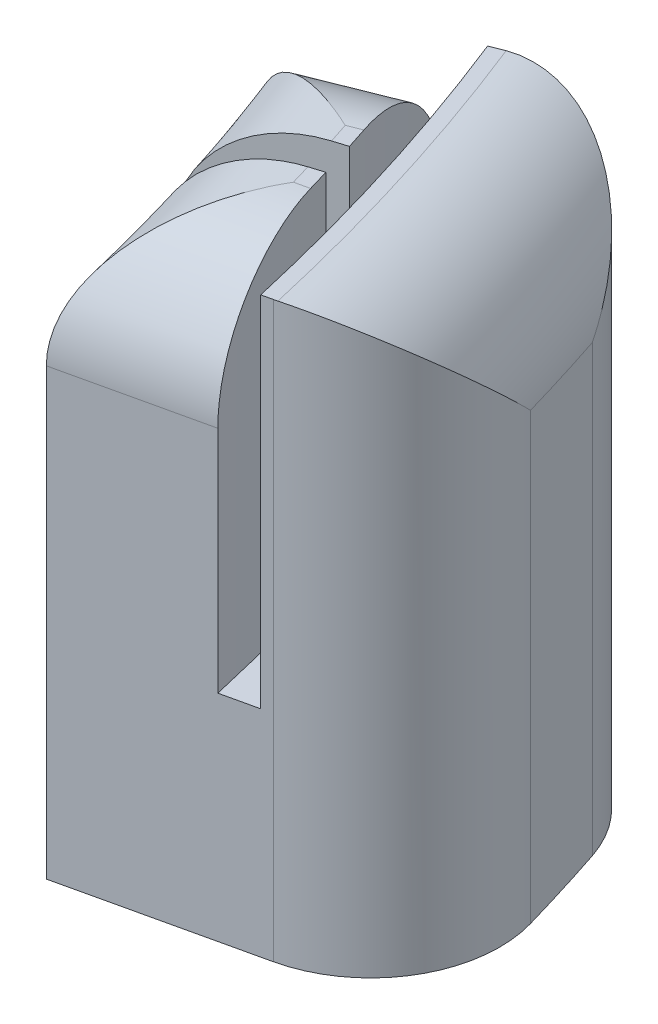
from build123d import *

# Parameters (mm, degrees)
EXTRUDE_1_DEPTH     = 400
CUT_EXTRUDE_START   = -250
CUT_EXTRUDE_1_DEPTH = 250
SKETCH_3_R          = 15.665420251
SKETCH_3_R_2        = 18.510518013
CUT_EXTRUDE_2_DEPTH = 50
FILLET_2_R          = 90
FILLET_3_R          = 90
EXTRUDE_START       = 50
SKETCH_4_R          = 18.510518013
SKETCH_4_R_2        = 15.665420251
EXTRUDE_2_DEPTH     = 50
SKETCH_8_R          = 25
CUT_EXTRUDE_3_DEPTH = 100


with BuildPart() as part:
    # 草图1 → 凸台-拉伸1 (new body)
    with BuildSketch(Plane(origin=(0, 0, 0), x_dir=(1, 0, 0), z_dir=(0, 1, 0))):
        with BuildLine():
            ThreePointArc((1355.07847299, 407.415429308), (1351.426521797, 419.370189907), (1347.669105677, 431.292222979))
            ThreePointArc((1347.669105677, 431.292222979), (1331.935587475, 477.674147112), (1314.606303382, 523.483779222))
            Line((1314.606303382, 523.483779222), (1407.51134249, 560.479099308))
            Line((1407.51134249, 560.479099308), (1430.737602267, 569.72792933))
            Line((1430.737602267, 569.72792933), (1523.642641375, 606.723249416))
            ThreePointArc((1523.642641375, 606.723249416), (1566.317664839, 486.054495722), (1599.452391748, 362.425228886))
            Line((1599.452391748, 362.425228886), (1501.924806885, 340.326129564))
            Line((1501.924806885, 340.326129564), (1477.542910669, 334.801354733))
            Line((1477.542910669, 334.801354733), (1380.015325807, 312.702255411))
            ThreePointArc((1380.015325807, 312.702255411), (1368.366605987, 360.27466136), (1355.07847299, 407.415429308))
        make_face()
    extrude(amount=EXTRUDE_1_DEPTH)

    # 草图2 → 切除-拉伸1 (cut)
    with BuildSketch(Plane(origin=(0, 400, 0), x_dir=(1, 0, 0), z_dir=(0, 1, 0)).offset(CUT_EXTRUDE_START)):
        with BuildLine():
            Line((1347.669105677, 431.292222979), (1443.179761176, 460.930772385))
            ThreePointArc((1443.179761176, 460.930772385), (1426.214363088, 511.016233129), (1407.51134249, 560.479099308))
            Line((1407.51134249, 560.479099308), (1430.737602267, 569.72792933))
            ThreePointArc((1430.737602267, 569.72792933), (1470.810490154, 456.417026471), (1501.924806885, 340.326129564))
            Line((1501.924806885, 340.326129564), (1477.542910669, 334.801354733))
            ThreePointArc((1477.542910669, 334.801354733), (1464.958432674, 386.162906732), (1450.589128489, 437.053978714))
            Line((1450.589128489, 437.053978714), (1355.07847299, 407.415429308))
            ThreePointArc((1355.07847299, 407.415429308), (1351.426521797, 419.370189907), (1347.669105677, 431.292222979))
        make_face()
    extrude(amount=CUT_EXTRUDE_1_DEPTH, mode=Mode.SUBTRACT)

    # 草图3 → 切除-拉伸2 (cut)
    with BuildSketch(Plane.XZ):
        with Locations(Location((1537.673756185, -404.548414334, 0), (0, 0, 270))):
            Circle(SKETCH_3_R)
        with Locations(Location((1496.563725778, -537.026083805, 0), (0, 0, 270))):
            Circle(SKETCH_3_R_2)
    extrude(amount=-CUT_EXTRUDE_2_DEPTH, mode=Mode.SUBTRACT)

    # 圆角2
    fillet_2_edges = [part.edges().sort_by_distance(p)[0] for p in [
        (1523.642641375, 200, -606.723249416),
        (1599.452391748, 200, -362.425228886),
        (1566.317664839, 400, -486.054495722),
    ]]
    fillet(fillet_2_edges, radius=FILLET_2_R)

    # 圆角3
    # the kernel refuses this fillet: 90 mm, written as the material it takes off along each edge
    with BuildSketch(Plane(origin=(0, 400, 0), x_dir=(0.9886635459067241, 0, -0.15014790373209708), z_dir=(0.15014790373209708, 0, 0.9886635459067241))) as fillet_3_piece_1_section:
        with BuildLine():
            CenterArc((1415 + FILLET_3_R, -FILLET_3_R), FILLET_3_R, 90, 90)
            Line((1415 + FILLET_3_R, 0), (1415 + FILLET_3_R, FILLET_3_R * 0.02))
            Line((1415 + FILLET_3_R, FILLET_3_R * 0.02), (1415 - FILLET_3_R * 0.02, FILLET_3_R * 0.02))
            Line((1415 - FILLET_3_R * 0.02, FILLET_3_R * 0.02), (1415 - FILLET_3_R * 0.02, -FILLET_3_R))
            Line((1415 - FILLET_3_R * 0.02, -FILLET_3_R), (1415, -FILLET_3_R))
        make_face()
    fillet_3_piece_1 = revolve(axis=Axis((0, 400, 0), (0, 1, 0)), revolution_arc=13.077233198, mode=Mode.PRIVATE)
    fillet_3_piece_1 = split(fillet_3_piece_1, bisect_by=Plane(origin=(1365.899074688, 379.798837266, -436.949286418), z_dir=(-0.2963746925135586, 0, -0.9550717468533417)), keep=Keep.TOP, mode=Mode.PRIVATE)
    add(fillet_3_piece_1, mode=Mode.SUBTRACT)
    with BuildSketch(Plane(origin=(1696.97997661, 400, -384.524328208), x_dir=(0, -1, 0), z_dir=(-0.9752758486265656, 0, 0.22099099322310048))) as fillet_3_piece_2_section:
        with BuildLine():
            CenterArc((FILLET_3_R, -FILLET_3_R), FILLET_3_R, 90, 90)
            Line((0, -FILLET_3_R), (-FILLET_3_R * 0.02, -FILLET_3_R))
            Line((-FILLET_3_R * 0.02, -FILLET_3_R), (-FILLET_3_R * 0.02, FILLET_3_R * 0.02))
            Line((-FILLET_3_R * 0.02, FILLET_3_R * 0.02), (FILLET_3_R, FILLET_3_R * 0.02))
            Line((FILLET_3_R, FILLET_3_R * 0.02), (FILLET_3_R, 0))
        make_face()
    fillet_3_piece_2 = extrude(amount=550, mode=Mode.PRIVATE)
    fillet_3_piece_2 = fillet_3_piece_2 - Plane(origin=(0, 379.627251668, 0), x_dir=(0.9752758486265642, 0, -0.22099099322310606), z_dir=(0, -1, 0)) * Cylinder(1415, 1461, mode=Mode.PRIVATE)
    fillet_3_piece_2 = fillet_3_piece_2 & Plane(origin=(0, 379.627251668, 0), x_dir=(0.9752758486265641, 0, -0.22099099322310678), z_dir=(0, -1, 0)) * Cylinder(1515, 1461, mode=Mode.PRIVATE)
    add(fillet_3_piece_2, mode=Mode.SUBTRACT)
    with BuildSketch(Plane(origin=(1105.569965388, 400, -440.244309028), x_dir=(0, -1, 0), z_dir=(0.9290503910825915, 0, -0.36995320086368216))) as fillet_3_piece_3_section:
        with BuildLine():
            CenterArc((FILLET_3_R, -FILLET_3_R), FILLET_3_R, 90, 90)
            Line((0, -FILLET_3_R), (-FILLET_3_R * 0.02, -FILLET_3_R))
            Line((-FILLET_3_R * 0.02, -FILLET_3_R), (-FILLET_3_R * 0.02, FILLET_3_R * 0.02))
            Line((-FILLET_3_R * 0.02, FILLET_3_R * 0.02), (FILLET_3_R, FILLET_3_R * 0.02))
            Line((FILLET_3_R, FILLET_3_R * 0.02), (FILLET_3_R, 0))
        make_face()
    fillet_3_piece_3 = extrude(amount=550, mode=Mode.PRIVATE)
    fillet_3_piece_3 = fillet_3_piece_3 - Plane(origin=(0, 379.627145312, 0), x_dir=(0.9752758486265642, 0, -0.22099099322310606), z_dir=(0, -1, 0)) * Cylinder(1415, 1461, mode=Mode.PRIVATE)
    fillet_3_piece_3 = fillet_3_piece_3 & Plane(origin=(0, 379.627145312, 0), x_dir=(0.9525939017664254, 0, -0.30424473424764115), z_dir=(0, -1, 0)) * Cylinder(1515, 1461, mode=Mode.PRIVATE)
    add(fillet_3_piece_3, mode=Mode.SUBTRACT)
    with BuildSketch(Plane(origin=(0, 400, 0), x_dir=(0.9752758486265642, 0, -0.22099099322310606), z_dir=(0.22099099322310606, 0, 0.9752758486265642))) as fillet_3_piece_4_section:
        with BuildLine():
            CenterArc((1415 + FILLET_3_R, -FILLET_3_R), FILLET_3_R, 90, 90)
            Line((1415 + FILLET_3_R, 0), (1415 + FILLET_3_R, FILLET_3_R * 0.02))
            Line((1415 + FILLET_3_R, FILLET_3_R * 0.02), (1415 - FILLET_3_R * 0.02, FILLET_3_R * 0.02))
            Line((1415 - FILLET_3_R * 0.02, FILLET_3_R * 0.02), (1415 - FILLET_3_R * 0.02, -FILLET_3_R))
            Line((1415 - FILLET_3_R * 0.02, -FILLET_3_R), (1415, -FILLET_3_R))
        make_face()
    fillet_3_piece_4 = revolve(axis=Axis((0, 400, 0), (0, 1, 0)), revolution_arc=13.077233198, mode=Mode.PRIVATE)
    fillet_3_piece_4 = split(fillet_3_piece_4, bisect_by=Plane(origin=(1373.308440607, 379.798836933, -413.072492314), z_dir=(0.29637469251355963, 0, 0.9550717468533415)), keep=Keep.TOP, mode=Mode.PRIVATE)
    add(fillet_3_piece_4, mode=Mode.SUBTRACT)
    with BuildSketch(Plane(origin=(0, 400, 0), x_dir=(0.9886635459067241, 0, -0.15014790373209708), z_dir=(0.15014790373209708, 0, 0.9886635459067241))) as fillet_3_piece_5a_section:
        with BuildLine():
            CenterArc((1415 + FILLET_3_R, -FILLET_3_R), FILLET_3_R, 90, 90)
            Line((1415 + FILLET_3_R, 0), (1415 + FILLET_3_R, FILLET_3_R * 0.02))
            Line((1415 + FILLET_3_R, FILLET_3_R * 0.02), (1415 - FILLET_3_R * 0.02, FILLET_3_R * 0.02))
            Line((1415 - FILLET_3_R * 0.02, FILLET_3_R * 0.02), (1415 - FILLET_3_R * 0.02, -FILLET_3_R))
            Line((1415 - FILLET_3_R * 0.02, -FILLET_3_R), (1415, -FILLET_3_R))
        make_face()
    fillet_3_piece_5a = revolve(axis=Axis((0, 400, 0), (0, 1, 0)), revolution_arc=22.187876624, mode=Mode.PRIVATE)
    fillet_3_piece_5a = split(fillet_3_piece_5a, bisect_by=Plane(origin=(1328.166352614, 379.779381403, -528.883468696), z_dir=(-0.3699532008636821, 0, -0.9290503910825915)), keep=Keep.TOP, mode=Mode.PRIVATE)
    with BuildSketch(Plane(origin=(1105.569965388, 400, -440.244309028), x_dir=(0, -1, 0), z_dir=(0.9290503910825915, 0, -0.36995320086368216))) as fillet_3_piece_5b_section:
        with BuildLine():
            CenterArc((FILLET_3_R, -FILLET_3_R), FILLET_3_R, 90, 90)
            Line((0, -FILLET_3_R), (-FILLET_3_R * 0.02, -FILLET_3_R))
            Line((-FILLET_3_R * 0.02, -FILLET_3_R), (-FILLET_3_R * 0.02, FILLET_3_R * 0.02))
            Line((-FILLET_3_R * 0.02, FILLET_3_R * 0.02), (FILLET_3_R, FILLET_3_R * 0.02))
            Line((FILLET_3_R, FILLET_3_R * 0.02), (FILLET_3_R, 0))
        make_face()
    fillet_3_piece_5b = extrude(amount=550, mode=Mode.PRIVATE)
    fillet_3_piece_5b = fillet_3_piece_5b & Plane(origin=(0, 379.605879508, 0), x_dir=(0.9752758486265642, 0, -0.22099099322310606), z_dir=(0, -1, 0)) * Cylinder(1415, 1461, mode=Mode.PRIVATE)
    fillet_3_piece_5 = fillet_3_piece_5a & fillet_3_piece_5b
    add(fillet_3_piece_5, mode=Mode.SUBTRACT)
    with BuildSketch(Plane(origin=(1696.97997661, 400, -384.524328208), x_dir=(0, -1, 0), z_dir=(-0.9752758486265656, 0, 0.22099099322310048))) as fillet_3_piece_6a_section:
        with BuildLine():
            CenterArc((FILLET_3_R, -FILLET_3_R), FILLET_3_R, 90, 90)
            Line((0, -FILLET_3_R), (-FILLET_3_R * 0.02, -FILLET_3_R))
            Line((-FILLET_3_R * 0.02, -FILLET_3_R), (-FILLET_3_R * 0.02, FILLET_3_R * 0.02))
            Line((-FILLET_3_R * 0.02, FILLET_3_R * 0.02), (FILLET_3_R, FILLET_3_R * 0.02))
            Line((FILLET_3_R, FILLET_3_R * 0.02), (FILLET_3_R, 0))
        make_face()
    fillet_3_piece_6a = extrude(amount=550, mode=Mode.PRIVATE)
    fillet_3_piece_6a = fillet_3_piece_6a & Plane(origin=(0, 379.60590325, 0), x_dir=(0.9752758486265642, 0, -0.22099099322310606), z_dir=(0, -1, 0)) * Cylinder(1415, 1461, mode=Mode.PRIVATE)
    with BuildSketch(Plane(origin=(0, 400, 0), x_dir=(0.9979642112015443, 0, -0.06377643107668678), z_dir=(0.06377643107668678, 0, 0.9979642112015443))) as fillet_3_piece_6b_section:
        with BuildLine():
            CenterArc((1415 + FILLET_3_R, -FILLET_3_R), FILLET_3_R, 90, 90)
            Line((1415 + FILLET_3_R, 0), (1415 + FILLET_3_R, FILLET_3_R * 0.02))
            Line((1415 + FILLET_3_R, FILLET_3_R * 0.02), (1415 - FILLET_3_R * 0.02, FILLET_3_R * 0.02))
            Line((1415 - FILLET_3_R * 0.02, FILLET_3_R * 0.02), (1415 - FILLET_3_R * 0.02, -FILLET_3_R))
            Line((1415 - FILLET_3_R * 0.02, -FILLET_3_R), (1415, -FILLET_3_R))
        make_face()
    fillet_3_piece_6b = revolve(axis=Axis((0, 400, 0), (0, 1, 0)), revolution_arc=22.187876624, mode=Mode.PRIVATE)
    fillet_3_piece_6b = split(fillet_3_piece_6b, bisect_by=Plane(origin=(1394.250064092, 379.779381346, -315.927752029), z_dir=(0.22099099322310004, 0, 0.9752758486265657)), keep=Keep.TOP, mode=Mode.PRIVATE)
    fillet_3_piece_6 = fillet_3_piece_6a & fillet_3_piece_6b
    add(fillet_3_piece_6, mode=Mode.SUBTRACT)

    # 草图4 → 凸台-拉伸2 (add)
    with BuildSketch(Plane.XZ.offset(-50).offset(EXTRUDE_START)):
        with Locations((1496.563725778, -537.026083805)):
            Circle(SKETCH_4_R)
        with Locations((1537.673756185, -404.548414334)):
            Circle(SKETCH_4_R_2)
    extrude(amount=-EXTRUDE_2_DEPTH)

    # 草图8 → 切除-拉伸3 (cut)
    with BuildSketch(Plane.XZ):
        with Locations(Location((1431.534758427, -375.643761315, 0), (0, 0, 270))):
            Circle(SKETCH_8_R)
        with Locations(Location((1392.707343884, -500.765668043, 0), (0, 0, 270))):
            Circle(SKETCH_8_R)
    extrude(amount=-CUT_EXTRUDE_3_DEPTH, mode=Mode.SUBTRACT)


solid = part.part
